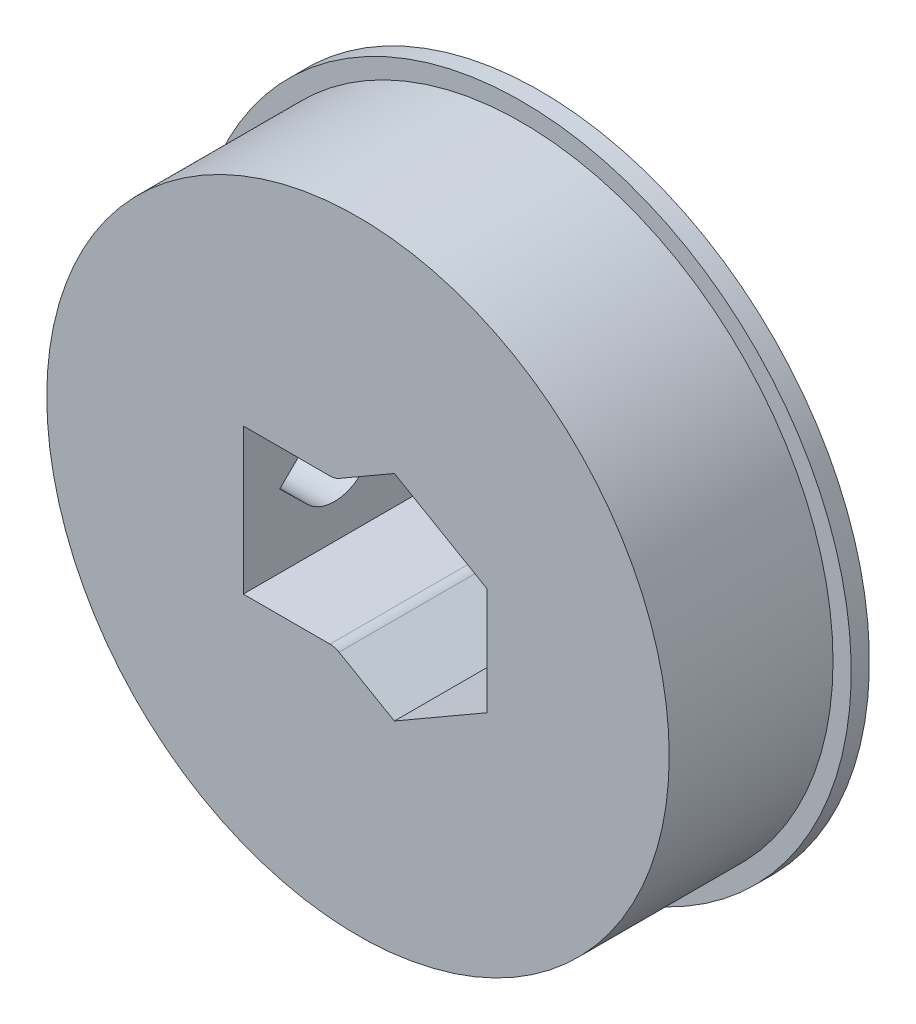
from build123d import *

# Parameters (mm, degrees)
SKETCH1_R                   = 8.55
BOSS_EXTRUDE1_DEPTH         = 5
M2_HEXNUT_CUTOUT_DEPTH      = 1.5
M2_HEXNUT_CUTOUT_DEPTH_BACK = 1.6
SKETCH2_W                   = 5
SKETCH2_H                   = 4
FILLET1_R                   = 0.5
M2_THRU_DEPTH               = 16.329465092
SKETCH4_R                   = 9.05
SKETCH4_R_2                 = 8.55
BOSS_EXTRUDE2_DEPTH         = 0.5


with BuildPart() as part:
    # Sketch1 → Boss-Extrude1 (new body)
    with BuildSketch(Plane.XY):
        with Locations((-1, 0)):
            Circle(SKETCH1_R)
        Polygon((0, -2.944486373), (2.55, -1.472243186), (2.55, 1.472243186), (0, 2.944486373), (-2.55, 1.472243186), (-2.55, -1.472243186), align=None, mode=Mode.SUBTRACT)
    extrude(amount=BOSS_EXTRUDE1_DEPTH)

    # Sketch2 → M2 Hexnut Cutout (cut, two sides: drawn at the far end of the back side and taken through both)
    with BuildSketch(Plane(origin=(-2.55, 0, 0), x_dir=(0, 0, -1), z_dir=(1, 0, 0)).offset(-M2_HEXNUT_CUTOUT_DEPTH_BACK)):
        with Locations((-2.5, 0)):
            Rectangle(SKETCH2_W, SKETCH2_H)
    extrude(amount=M2_HEXNUT_CUTOUT_DEPTH + M2_HEXNUT_CUTOUT_DEPTH_BACK, mode=Mode.SUBTRACT)

    # Fillet1
    fillet1_edges = [part.edges().sort_by_distance(p)[0] for p in [
        (-1.635898385, -2, 2.5),
        (-1.635898385, 2, 2.5),
    ]]
    fillet(fillet1_edges, radius=FILLET1_R)

    # Sketch3 → M2 Thru (cut, through all)
    with BuildSketch(Plane(origin=(-4.15, 0, 0), x_dir=(0, 0, -1), z_dir=(1, 0, 0))):
        with BuildLine():
            Line((-1.765, -0.749849985), (-1, 0))
            Line((-1, 0), (-1.765, 0.749849985))
            ThreePointArc((-1.765, 0.749849985), (-2.5, 1.05), (-3.235, 0.749849985))
            Line((-3.235, 0.749849985), (-4, 0))
            Line((-4, 0), (-3.235, -0.749849985))
            ThreePointArc((-3.235, -0.749849985), (-2.5, -1.05), (-1.765, -0.749849985))
        make_face()
    extrude(amount=-M2_THRU_DEPTH, mode=Mode.SUBTRACT)

    # Sketch4 → Boss-Extrude2 (add)
    with BuildSketch(Plane(origin=(0, 0, 0), x_dir=(-1, 0, 0), z_dir=(0, 0, -1))):
        with Locations((1, 0)):
            Circle(SKETCH4_R)
        with Locations((1, 0)):
            Circle(SKETCH4_R_2, mode=Mode.SUBTRACT)
    extrude(amount=-BOSS_EXTRUDE2_DEPTH)


solid = part.part
